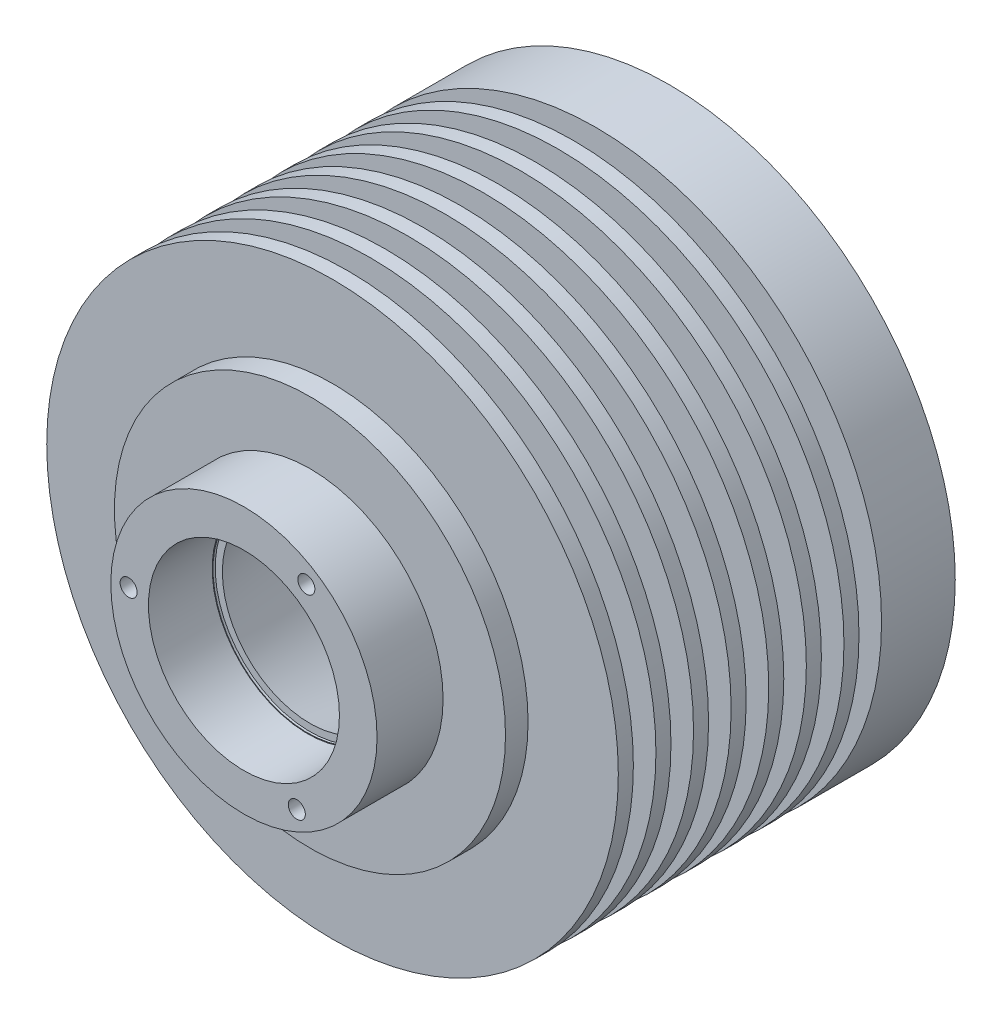
from build123d import *

# Parameters (mm, degrees)
ESQUISSE1_R         = 17.7
ESQUISSE1_R_2       = 12.7
BOSS_EXTRU_1_DEPTH  = 8.78
ESQUISSE2_R         = 38
ESQUISSE2_R_2       = 11.2
BOSS_EXTRU_2_DEPTH  = 47.8
CHANFREIN3_SIZE     = 11.200084029
CHANFREIN3_SIZE_2   = 49.8
SKETCH7_R           = 38
SKETCH7_R_2         = 26
CUT_EXTRUDE2_DEPTH  = 3
CIRPATTERN1_COUNT   = 4
CIRPATTERN2_COUNT   = 3
SKETCH23_R          = 13.7
SKETCH23_R_2        = 12.6
BOSS_EXTRUDE1_DEPTH = 0.3
LPATTERN1_COUNT     = 8
LPATTERN1_PITCH     = 5


with BuildPart() as part:
    # Esquisse1 → Boss.-Extru.1 (new body)
    with BuildSketch(Plane.XY):
        Circle(ESQUISSE1_R)
        Circle(ESQUISSE1_R_2, mode=Mode.SUBTRACT)
    extrude(amount=BOSS_EXTRU_1_DEPTH)

    # Esquisse2 → Boss.-Extru.2 (add)
    with BuildSketch(Plane(origin=(0, 0, 0), x_dir=(-1, 0, 0), z_dir=(0, 0, -1))):
        with Locations(Location((0, 0, 0), (0, 0, 180))):
            Circle(ESQUISSE2_R)
        with Locations(Location((0, 0, 0), (0, 0, 180))):
            Circle(ESQUISSE2_R_2, mode=Mode.SUBTRACT)
    extrude(amount=BOSS_EXTRU_2_DEPTH)

    # Chanfrein3
    # the kernel refuses this chamfer: 49.8, 11.200084029 mm, written as the material it takes off along each edge
    with BuildSketch(Plane(origin=(0, 0, -47.8), x_dir=(1, 0, 0), z_dir=(0, 1, 0))) as chanfrein3_piece_1:
        Polygon((11.2 + CHANFREIN3_SIZE, 0), (11.2, -CHANFREIN3_SIZE_2), (11.2, 0), align=None)
    revolve(axis=Axis((0, 0, -47.8), (0, 0, -1)), mode=Mode.SUBTRACT)

    # Sketch7 → Cut-Extrude2 (cut)
    with BuildSketch(Plane.XY):
        Circle(SKETCH7_R)
        Circle(SKETCH7_R_2, mode=Mode.SUBTRACT)
    cut_extrude2 = extrude(amount=-CUT_EXTRUDE2_DEPTH, mode=Mode.SUBTRACT)

    # Sketch19 → #4-40 Tapped Hole1 (revolve, cut)
    with BuildSketch(Plane(origin=(13.743816873, -26.666598917, -47.8), x_dir=(0, 1, 0), z_dir=(1, 0, 0))):
        Polygon((0, 0), (0, 5.679152758), (1.1303, 5), (1.1303, 0), align=None)
    f_4_40_tapped_hole1 = revolve(axis=Axis((13.743816873, -26.666598917, -54.15), (0, 0, 1)), mode=Mode.SUBTRACT)

    # CirPattern1: #4-40 Tapped Hole1 ×4 about axis
    cirpattern1_axis = Axis((0, 0, 0), (0, 0, 1))
    for i in range(1, CIRPATTERN1_COUNT):
        add(f_4_40_tapped_hole1.rotate(cirpattern1_axis, i * 360 / CIRPATTERN1_COUNT), mode=Mode.SUBTRACT)

    # Sketch22 → #4-40 Tapped Hole2 (revolve, cut)
    with BuildSketch(Plane(origin=(7.032252966, -13.644409779, 8.78), x_dir=(0, -1, 0), z_dir=(1, 0, 0))):
        Polygon((0, 0), (0, 5.679152758), (1.1303, 5), (1.1303, 0), align=None)
    f_4_40_tapped_hole2 = revolve(axis=Axis((7.032252966, -13.644409779, 15.13), (0, 0, -1)), mode=Mode.SUBTRACT)

    # CirPattern2: #4-40 Tapped Hole2 ×3 about axis
    cirpattern2_axis = Axis((0, 0, 0), (0, 0, 1))
    for i in range(1, CIRPATTERN2_COUNT):
        add(f_4_40_tapped_hole2.rotate(cirpattern2_axis, i * 360 / CIRPATTERN2_COUNT), mode=Mode.SUBTRACT)

    # Sketch23 → Boss-Extrude1 (add)
    with BuildSketch(Plane.XY):
        Circle(SKETCH23_R)
        Circle(SKETCH23_R_2, mode=Mode.SUBTRACT)
    extrude(amount=BOSS_EXTRUDE1_DEPTH)

    # LPattern1: Cut-Extrude2 ×8
    with Locations(*[(0, 0, -i * LPATTERN1_PITCH) for i in range(1, LPATTERN1_COUNT)]):
        add(cut_extrude2, mode=Mode.SUBTRACT)


solid = part.part
